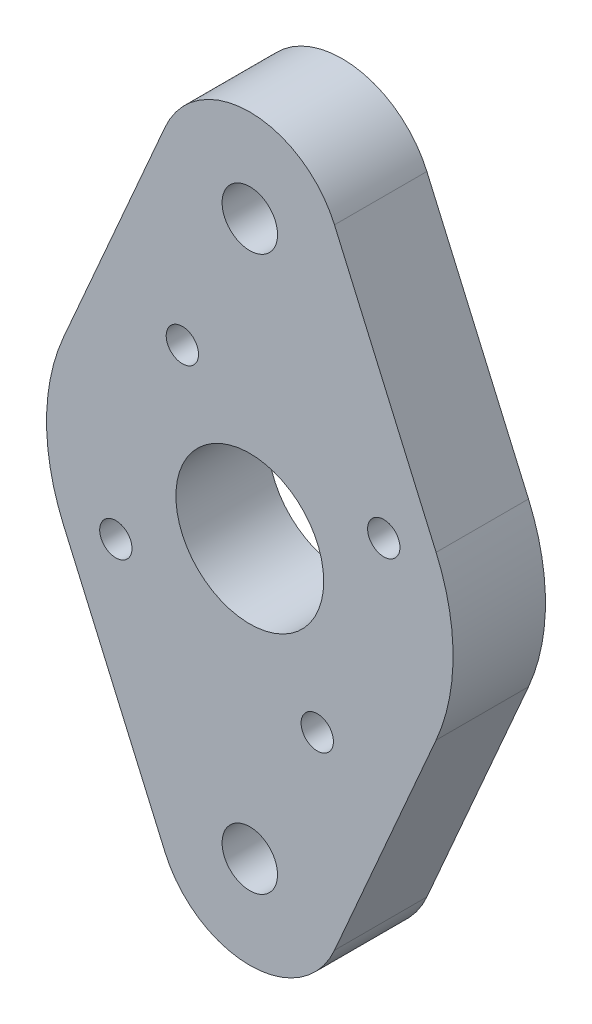
from build123d import *

# Parameters (mm, degrees)
ESQUISSE1_R        = 4
ESQUISSE1_R_2      = 0.875
ESQUISSE1_R_3      = 1.5
BOSS_EXTRU_1_DEPTH = 5


with BuildPart() as part:
    # Esquisse1 → Boss.-Extru.1 (new body)
    with BuildSketch(Plane.XY):
        with BuildLine():
            Line((-10.081666529, 4.4), (-4.582575695, 17))
            ThreePointArc((-4.582575695, 17), (0, 20), (4.582575695, 17))
            Line((4.582575695, 17), (10.081666529, 4.4))
            ThreePointArc((10.081666529, 4.4), (11, 0), (10.081666529, -4.4))
            Line((10.081666529, -4.4), (4.582575695, -17))
            ThreePointArc((4.582575695, -17), (0, -20), (-4.582575695, -17))
            Line((-4.582575695, -17), (-10.081666529, -4.4))
            ThreePointArc((-10.081666529, -4.4), (-11, 0), (-10.081666529, 4.4))
        make_face()
        Circle(ESQUISSE1_R, mode=Mode.SUBTRACT)
        with Locations((7.25, 3.65)):
            Circle(ESQUISSE1_R_2, mode=Mode.SUBTRACT)
        with Locations((3.65, -7.25)):
            Circle(ESQUISSE1_R_2, mode=Mode.SUBTRACT)
        with Locations((-7.25, -3.65)):
            Circle(ESQUISSE1_R_2, mode=Mode.SUBTRACT)
        with Locations((-3.65, 7.25)):
            Circle(ESQUISSE1_R_2, mode=Mode.SUBTRACT)
        with Locations((0, 15)):
            Circle(ESQUISSE1_R_3, mode=Mode.SUBTRACT)
        with Locations((0, -15)):
            Circle(ESQUISSE1_R_3, mode=Mode.SUBTRACT)
    extrude(amount=BOSS_EXTRU_1_DEPTH)


solid = part.part
